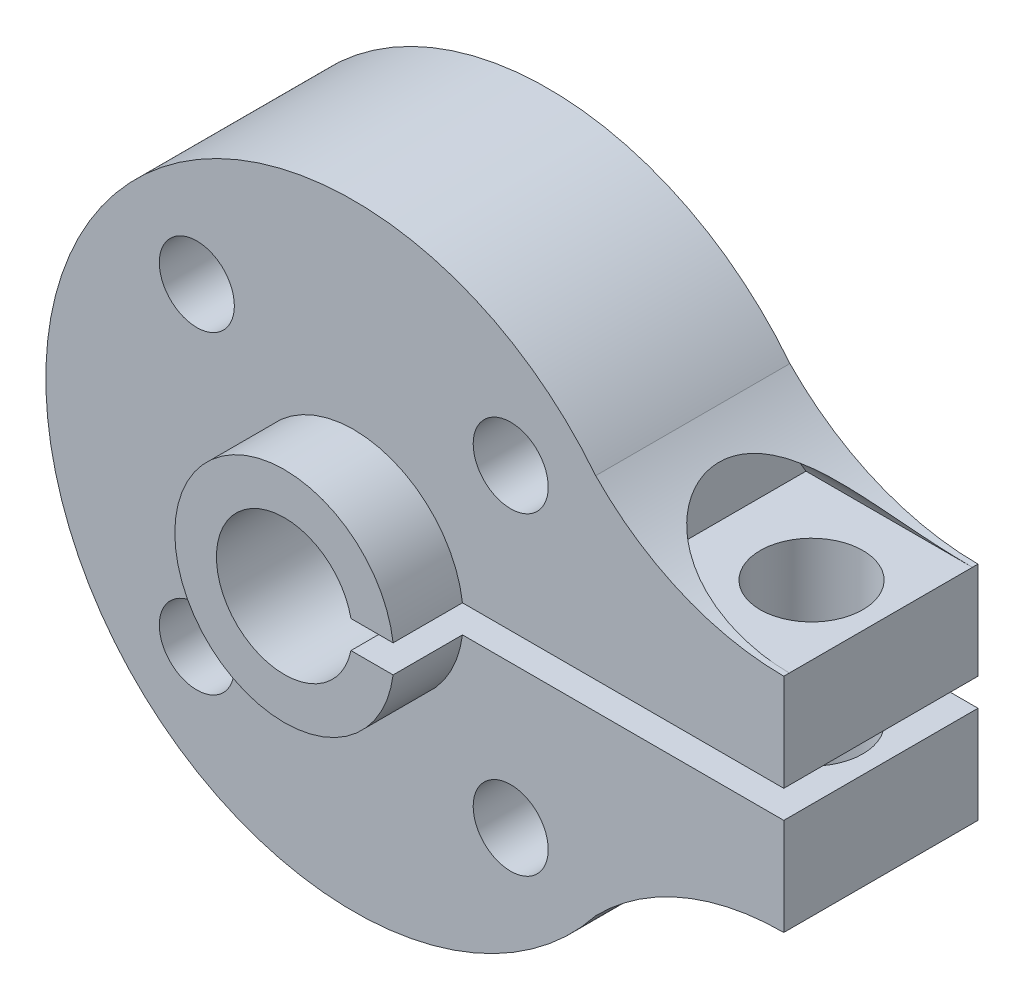
from build123d import *

# Parameters (mm, degrees)
CUT_EXTRUDE1_START             = -0.2
CUT_EXTRUDE1_DEPTH             = 0.2
CUT_EXTRUDE1_START_2           = -7
CUT_EXTRUDE1_2_DEPTH           = 0.1999999
CUT_EXTRUDE1_START_3           = -6.8000001
CUT_EXTRUDE1_3_DEPTH           = 6.6000001
CUT_EXTRUDE1_START_4           = 9.5
CUT_EXTRUDE1_4_DEPTH           = 6.5
SKETCH2_R                      = 3.95
BOSS_EXTRUDE1_DEPTH            = 2.5
CUT_EXTRUDE2_DEPTH             = 22.300469551
SKETCH4_W                      = 2.45
SKETCH4_H                      = 9.5
M2_5_CLEARANCE_HOLE1_D         = 2.7051
M2_5_CLEARANCE_HOLE1_DEPTH     = 9.5
SKETCH7_W                      = 1.35255
SKETCH7_H                      = 10.6
F_3_7_3_7_DIAMETER_HOLE1_D     = 3.7
F_3_7_3_7_DIAMETER_HOLE1_DEPTH = 15.1


with BuildPart() as part:
    # Cut-Extrude1: read off the stored shape, not the designer's step
    # Cut-Extrude1 outline → Cut-Extrude1 (new body)
    with BuildSketch(Plane.XY.offset(CUT_EXTRUDE1_START)):
        with BuildLine():
            ThreePointArc((8.719864541, -6.868330393), (11.819050527, -4.746581358), (15.5, -4))
            Line((15.5, -4), (15.5, 4))
            ThreePointArc((15.5, 4), (11.819050527, 4.746581358), (8.719864541, 6.868330393))
            ThreePointArc((8.719864541, 6.868330393), (-11.1, 0), (8.719864541, -6.868330393))
        make_face()
    extrude(amount=CUT_EXTRUDE1_DEPTH)



with BuildPart() as body_2:
    # Cut-Extrude1 2 outline → Cut-Extrude1 2 (new body)
    with BuildSketch(Plane.XY.offset(CUT_EXTRUDE1_START_2)):
        with BuildLine():
            ThreePointArc((8.719864541, -6.868330393), (11.819050527, -4.746581358), (15.5, -4))
            Line((15.5, -4), (15.5, 4))
            ThreePointArc((15.5, 4), (11.819050527, 4.746581358), (8.719864541, 6.868330393))
            ThreePointArc((8.719864541, 6.868330393), (-11.1, 0), (8.719864541, -6.868330393))
        make_face()
    extrude(amount=CUT_EXTRUDE1_2_DEPTH)


with BuildPart() as part_1:
    add(part.part)

    add(body_2.part)  # Cut-Extrude1 3 merges body 2
    # Cut-Extrude1 3 outline → Cut-Extrude1 3 (add)
    with BuildSketch(Plane.XY.offset(CUT_EXTRUDE1_START_3)):
        with BuildLine():
            ThreePointArc((8.719864541, -6.868330393), (11.819050527, -4.746581358), (15.5, -4))
            Line((15.5, -4), (15.5, 4))
            ThreePointArc((15.5, 4), (11.819050527, 4.746581358), (8.719864541, 6.868330393))
            ThreePointArc((8.719864541, 6.868330393), (-11.1, 0), (8.719864541, -6.868330393))
        make_face()
    extrude(amount=CUT_EXTRUDE1_3_DEPTH)

    # Cut-Extrude1 4 outline → Cut-Extrude1 4 (cut)
    with BuildSketch(Plane.YZ.offset(CUT_EXTRUDE1_START_4)):
        with BuildLine():
            ThreePointArc((4, -6.8), (6.016591059, -3.5), (4, -0.2))
            Line((4, -0.2), (4, -6.8))
        make_face()
    extrude(amount=CUT_EXTRUDE1_4_DEPTH, mode=Mode.SUBTRACT)

    # Sketch2 → Boss-Extrude1 (add)
    with BuildSketch(Plane.XY):
        Circle(SKETCH2_R)
    extrude(amount=BOSS_EXTRUDE1_DEPTH)

    # Sketch3 → Cut-Extrude2 (cut, through all)
    with BuildSketch(Plane(origin=(0, 0, -7), x_dir=(-1, 0, 0), z_dir=(0, 0, -1))):
        with BuildLine():
            Line((-15.5, 0.5), (-15.5, -0.5))
            Line((-15.5, -0.5), (-2.398436991, -0.5))
            ThreePointArc((-2.398436991, -0.5), (-2.45, 0), (-2.398436991, 0.5))
            Line((-2.398436991, 0.5), (-15.5, 0.5))
        make_face()
    extrude(amount=-CUT_EXTRUDE2_DEPTH, mode=Mode.SUBTRACT)

    # Sketch4 → Cut-Revolve1 (revolve, cut)
    with BuildSketch(Plane.XZ):
        with Locations((1.225, -2.25)):
            Rectangle(SKETCH4_W, SKETCH4_H)
    revolve(axis=Axis((0, 0, 2.5), (0, 0, -1)), mode=Mode.SUBTRACT)

    # M2.5 Clearance Hole1
    with Locations(Plane(origin=(0, 0, -7), x_dir=(-1, 0, 0), z_dir=(0, 0, -1))):
        with Locations((5.656516225, 5.657192254), (-5.657192254, 5.656516225), (-5.656516225, -5.657192254), (5.657192254, -5.656516225)):
            Hole(M2_5_CLEARANCE_HOLE1_D / 2, depth=M2_5_CLEARANCE_HOLE1_DEPTH)

    # Sketch7 → M2.5 Clearance Hole2 (revolve, cut)
    with BuildSketch(Plane(origin=(13, -0.5, -3.5), x_dir=(0, 0, 1), z_dir=(1, 0, 0))):
        with Locations((0.676275, 5.3)):
            Rectangle(SKETCH7_W, SKETCH7_H)
    revolve(axis=Axis((13, 5.85, -3.5), (0, -1, 0)), mode=Mode.SUBTRACT)

    # Ø3.7 (3.7) Diameter Hole1
    with Locations(Plane(origin=(0, 4, 0), x_dir=(1, 0, 0), z_dir=(0, 1, 0))):
        with Locations((13, 3.5)):
            Hole(F_3_7_3_7_DIAMETER_HOLE1_D / 2, depth=F_3_7_3_7_DIAMETER_HOLE1_DEPTH)


solid = part_1.part
